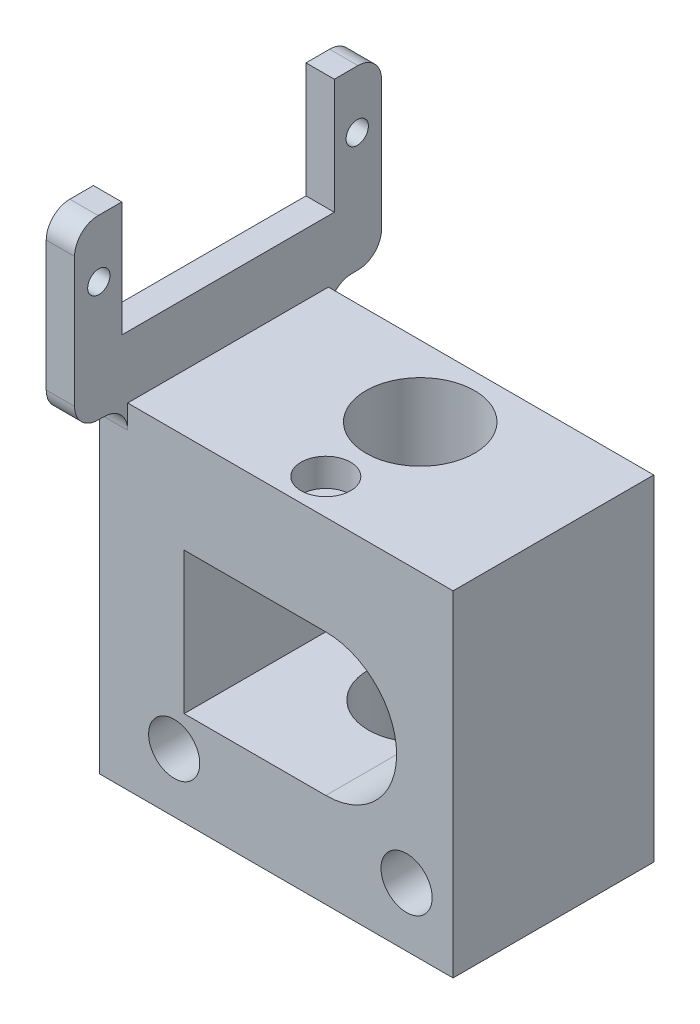
from build123d import *

# Parameters (mm, degrees)
SKETCH2_W            = 35
SKETCH2_H            = 36.068
BOSS_EXTRUDE1_DEPTH  = 21.59
M5_CLEARANCE_HOLE1_D = 5.5
SKETCH13_W           = 22.86
SKETCH13_H           = 15.24
CUT_EXTRUDE3_DEPTH   = 55.699439887
CUT_EXTRUDE1_REACH   = 56.699
SKETCH5_R            = 5.842
BOSS_EXTRUDE2_DEPTH  = 3.048
M2_CLEARANCE_HOLE1_D = 2.4
FILLET2_R            = 2.54
SKETCH11_R           = 2.667
CUT_EXTRUDE2_DEPTH   = 3
SKETCH14_R           = 5.588
CUT_EXTRUDE4_DEPTH   = 64.180572876
FILLET3_R            = 7.62


with BuildPart() as part:
    # Sketch2 → Boss-Extrude1 (new body)
    with BuildSketch(Plane.XY):
        with Locations((17.5, 18.034)):
            Rectangle(SKETCH2_W, SKETCH2_H)
    extrude(amount=BOSS_EXTRUDE1_DEPTH)

    # M5 Clearance Hole1 (through all)
    with Locations(Plane(origin=(0, 0, 0), x_dir=(1, 0, 0), z_dir=(0, 0, -1))):
        with Locations((5, -6.35), (30, -6.35)):
            Hole(M5_CLEARANCE_HOLE1_D / 2)

    # Sketch13 → Cut-Extrude3 (cut, through all)
    with BuildSketch(Plane.XY.offset(21.59)):
        with Locations((17.5, 17.78)):
            Rectangle(SKETCH13_W, SKETCH13_H)
    extrude(amount=-CUT_EXTRUDE3_DEPTH, mode=Mode.SUBTRACT)

    # Sketch5 → Cut-Extrude1 (cut, up to next)
    with BuildSketch(Plane(origin=(0, 36.068, 0), x_dir=(1, 0, 0), z_dir=(0, 1, 0)), mode=Mode.PRIVATE) as cut_extrude1_sk1:
        with Locations(Location((17.5, -7.62, 0), (0, 0, 270))):
            Circle(SKETCH5_R)
    cut_extrude1_tool1 = extrude(cut_extrude1_sk1.sketch, amount=-CUT_EXTRUDE1_REACH, mode=Mode.PRIVATE) & part.part
    add(cut_extrude1_tool1.solids().sort_by_distance((17.5, 36.068, 7.62))[0], mode=Mode.SUBTRACT)

    # Sketch7 → Boss-Extrude2 (add)
    with BuildSketch(Plane.ZY):
        Polygon((-5.715, 55.118), (-5.715, 36.068), (0, 36.068), (0, 0), (21.59, 0), (21.59, 36.068), (27.305, 36.068), (27.305, 55.118), (22.225, 55.118), (22.225, 42.7228), (-0.635, 42.7228), (-0.635, 55.118), align=None)
    extrude(amount=BOSS_EXTRUDE2_DEPTH)

    # M2 Clearance Hole1 (through all)
    with Locations(Plane.ZY.offset(3.048)):
        with Locations((-3.10388, 48.9204), (24.69388, 48.9204)):
            Hole(M2_CLEARANCE_HOLE1_D / 2)

    # Fillet2
    fillet2_edges = [part.edges().sort_by_distance(p)[0] for p in [
        (-1.524, 55.118, -5.715),
        (-1.524, 36.068, -5.715),
        (-1.524, 36.068, 0),
        (-1.524, 36.068, 21.59),
        (-1.524, 36.068, 27.305),
        (-1.524, 55.118, 27.305),
    ]]
    fillet(fillet2_edges, radius=FILLET2_R)

    # Sketch11 → Cut-Extrude2 (cut)
    with BuildSketch(Plane(origin=(0, 36.068, 0), x_dir=(1, 0, 0), z_dir=(0, 1, 0))):
        with Locations(Location((17.5, -17.78, 0), (0, 0, 270))):
            Circle(SKETCH11_R)
    extrude(amount=-CUT_EXTRUDE2_DEPTH, mode=Mode.SUBTRACT)

    # Sketch14 → Cut-Extrude4 (cut, through all)
    with BuildSketch(Plane(origin=(0, 10.16, 0), x_dir=(1, 0, 0), z_dir=(0, 1, 0))):
        with Locations(Location((17.5, -7.62, 0), (0, 0, 270))):
            Circle(SKETCH14_R)
    extrude(amount=-CUT_EXTRUDE4_DEPTH, mode=Mode.SUBTRACT)

    # Fillet3
    # the kernel refuses this fillet: 7.62 mm, written as the material it adds along each edge
    with BuildSketch(Plane(origin=(28.93, 25.4, 21.59), x_dir=(-1, 0, 0), z_dir=(0, 0, -1))) as fillet3_piece_1_section:
        with BuildLine():
            CenterArc((FILLET3_R, -FILLET3_R), FILLET3_R, 90, 90)
            Line((0, -FILLET3_R), (0, 0))
            Line((0, 0), (FILLET3_R, 0))
        make_face()
    fillet3_piece_1 = extrude(amount=21.59, mode=Mode.PRIVATE)
    fillet3_piece_1 = fillet3_piece_1 - Plane(origin=(17.5, 23.659865562, 7.62), x_dir=(0, 0, 1), z_dir=(0, 1, 0)) * Cylinder(5.842, 74, mode=Mode.PRIVATE)
    add(fillet3_piece_1)
    with BuildSketch(Plane(origin=(28.93, 10.16, 21.59), x_dir=(0, 1, 0), z_dir=(0, 0, -1))) as fillet3_piece_2_section:
        with BuildLine():
            CenterArc((FILLET3_R, -FILLET3_R), FILLET3_R, 90, 90)
            Line((0, -FILLET3_R), (0, 0))
            Line((0, 0), (FILLET3_R, 0))
        make_face()
    fillet3_piece_2 = extrude(amount=21.59, mode=Mode.PRIVATE)
    fillet3_piece_2 = fillet3_piece_2 - Plane(origin=(17.5, 11.896400625, 7.62), x_dir=(0, 0, 1), z_dir=(0, 1, 0)) * Cylinder(5.588, 74, mode=Mode.PRIVATE)
    add(fillet3_piece_2)


solid = part.part
